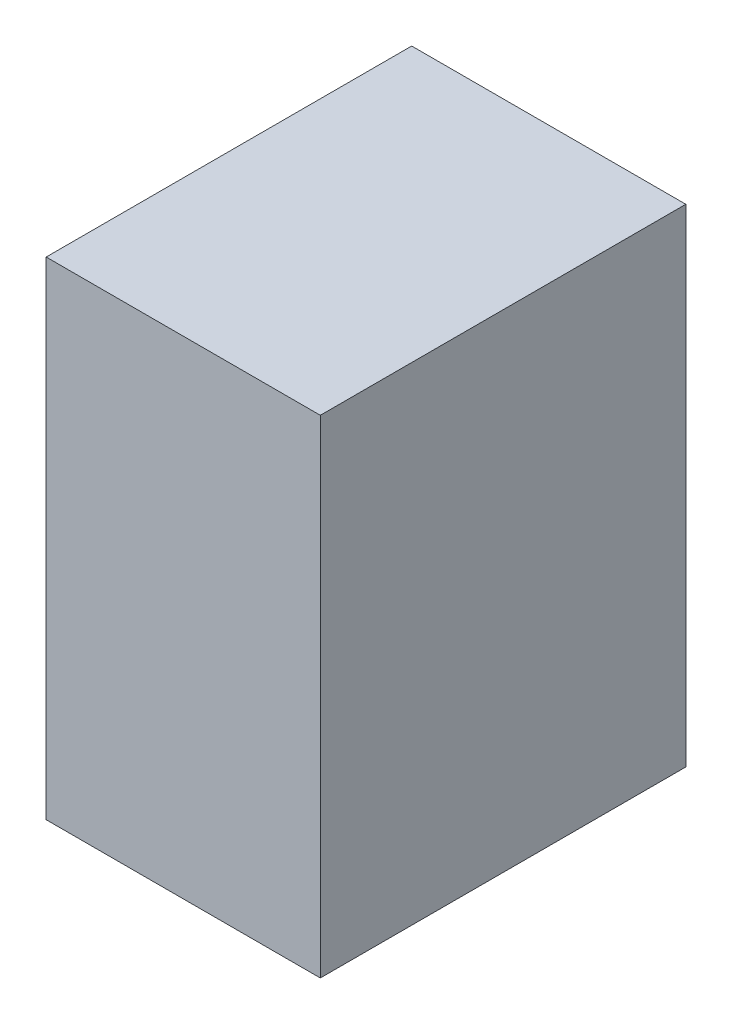
from build123d import *

# Parameters (mm, degrees)
SKETCH_1_W      = 450
SKETCH_1_H      = 600
EXTRUDE_1_DEPTH = 800


with BuildPart() as part:
    # Эскиз1 → Бобышка-Вытянуть1 (new body)
    with BuildSketch(Plane(origin=(0, 0, 0), x_dir=(1, 0, 0), z_dir=(0, 1, 0))):
        with Locations((225, 300)):
            Rectangle(SKETCH_1_W, SKETCH_1_H)
    extrude(amount=EXTRUDE_1_DEPTH)


solid = part.part
